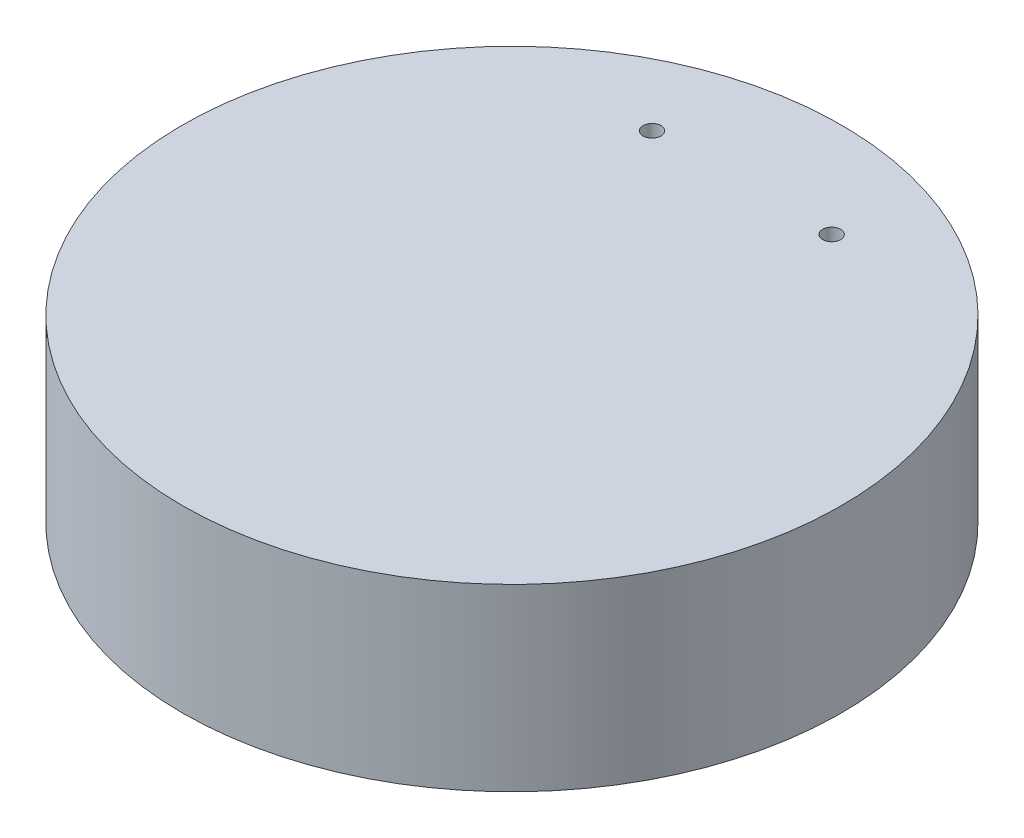
from build123d import *

# Parameters (mm, degrees)
SKETCH1_R           = 46.609
BOSS_EXTRUDE1_DEPTH = 25.4
SKETCH2_R           = 1.27
CUT_EXTRUDE1_DEPTH  = 25.4


with BuildPart() as part:
    # Sketch1 → Boss-Extrude1 (new body)
    with BuildSketch(Plane(origin=(0, 0, 0), x_dir=(1, 0, 0), z_dir=(0, 1, 0))):
        Circle(SKETCH1_R)
    extrude(amount=BOSS_EXTRUDE1_DEPTH)

    # Sketch2 → Cut-Extrude1 (cut)
    with BuildSketch(Plane(origin=(0, 25.4, 0), x_dir=(1, 0, 0), z_dir=(0, 1, 0))):
        with Locations((12.7, 32.512)):
            Circle(SKETCH2_R)
        with Locations((-12.7, 32.512)):
            Circle(SKETCH2_R)
    extrude(amount=-CUT_EXTRUDE1_DEPTH, mode=Mode.SUBTRACT)


solid = part.part
